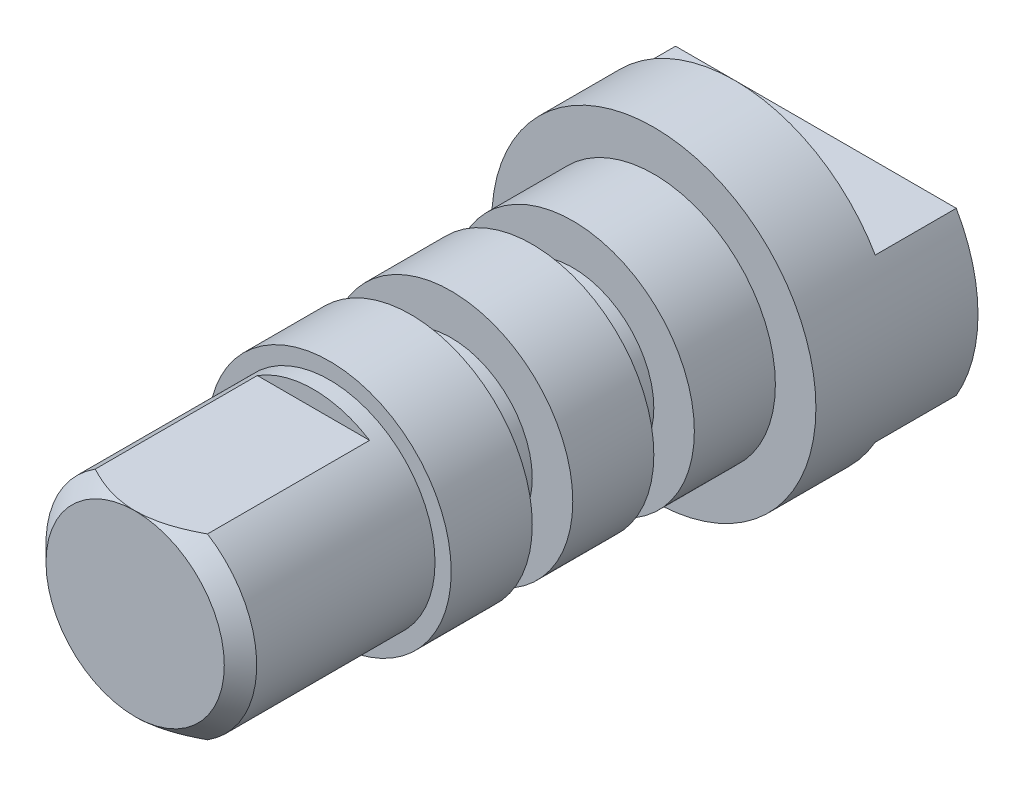
from build123d import *

# Parameters (mm, degrees)
SZKIC2_R                    = 10
DODANIE_WYCI_GNI_CIE1_DEPTH = 5
SZKIC3_R                    = 7.5
DODANIE_WYCI_GNI_CIE2_DEPTH = 5
SZKIC4_R                    = 5
DODANIE_WYCI_GNI_CIE3_DEPTH = 2.5
SZKIC5_R                    = 7.5
DODANIE_WYCI_GNI_CIE4_DEPTH = 5
SZKIC6_R                    = 5
DODANIE_WYCI_GNI_CIE5_DEPTH = 2.5
SZKIC7_R                    = 7.5
DODANIE_WYCI_GNI_CIE6_DEPTH = 5
SZKIC8_R                    = 6.5
DODANIE_WYCI_GNI_CIE7_DEPTH = 12
SZKIC10_W                   = 8
SZKIC10_H                   = 2
WYTNIJ_WYCI_GNI_CIE1_DEPTH  = 11
DODANIE_WYCI_GNI_CIE8_START = 5
SZKIC11_R                   = 10
DODANIE_WYCI_GNI_CIE8_DEPTH = 5
WYTNIJ_WYCI_GNI_CIE2_DEPTH  = 5


with BuildPart() as part:
    # Szkic2 → Dodanie-wyciągnięcie1 (new body)
    with BuildSketch(Plane.XY):
        Circle(SZKIC2_R)
    extrude(amount=DODANIE_WYCI_GNI_CIE1_DEPTH)

    # Szkic3 → Dodanie-wyciągnięcie2 (add)
    with BuildSketch(Plane.XY.offset(5)):
        Circle(SZKIC3_R)
    extrude(amount=DODANIE_WYCI_GNI_CIE2_DEPTH)

    # Szkic4 → Dodanie-wyciągnięcie3 (add)
    with BuildSketch(Plane.XY.offset(10)):
        Circle(SZKIC4_R)
    extrude(amount=DODANIE_WYCI_GNI_CIE3_DEPTH)

    # Szkic5 → Dodanie-wyciągnięcie4 (add)
    with BuildSketch(Plane.XY.offset(12.5)):
        Circle(SZKIC5_R)
    extrude(amount=DODANIE_WYCI_GNI_CIE4_DEPTH)

    # Szkic6 → Dodanie-wyciągnięcie5 (add)
    with BuildSketch(Plane.XY.offset(17.5)):
        Circle(SZKIC6_R)
    extrude(amount=DODANIE_WYCI_GNI_CIE5_DEPTH)

    # Szkic7 → Dodanie-wyciągnięcie6 (add)
    with BuildSketch(Plane.XY.offset(20)):
        Circle(SZKIC7_R)
    extrude(amount=DODANIE_WYCI_GNI_CIE6_DEPTH)

    # Szkic8 → Dodanie-wyciągnięcie7 (add)
    with BuildSketch(Plane.XY.offset(25)):
        Circle(SZKIC8_R)
    extrude(amount=DODANIE_WYCI_GNI_CIE7_DEPTH)

    # Szkic10 → Wytnij-wyciągnięcie1 (cut)
    with BuildSketch(Plane.XY.offset(37)):
        with Locations((0, 6.5)):
            Rectangle(SZKIC10_W, SZKIC10_H)
        with Locations((0, -6.5)):
            Rectangle(SZKIC10_W, SZKIC10_H)
    extrude(amount=-WYTNIJ_WYCI_GNI_CIE1_DEPTH, mode=Mode.SUBTRACT)

    # Szkic11 → Dodanie-wyciągnięcie8 (add)
    with BuildSketch(Plane(origin=(0, 0, 0), x_dir=(-1, 0, 0), z_dir=(0, 0, -1)).offset(DODANIE_WYCI_GNI_CIE8_START)):
        Circle(SZKIC11_R)
    extrude(amount=-DODANIE_WYCI_GNI_CIE8_DEPTH)

    # Szkic13 → Wytnij-wyciągnięcie2 (cut)
    with BuildSketch(Plane(origin=(0, 0, -5), x_dir=(-1, 0, 0), z_dir=(0, 0, -1))):
        with BuildLine():
            Line((-8.660254038, -5), (8.660254038, -5))
            ThreePointArc((8.660254038, -5), (0, -10), (-8.660254038, -5))
        make_face()
        with BuildLine():
            Line((-8.660254038, 5), (8.660254038, 5))
            ThreePointArc((8.660254038, 5), (0, 10), (-8.660254038, 5))
        make_face()
    extrude(amount=-WYTNIJ_WYCI_GNI_CIE2_DEPTH, mode=Mode.SUBTRACT)

    # Sfazowanie1: read off the stored shape, not the designer's step
    # Sfazowanie1 outline → Sfazowanie1 (revolve, cut)
    with BuildSketch(Plane.XZ):
        Polygon((6.5, 37.000001298), (5.499998702, 37.000001298), (6.5, 36), align=None)
    revolve(axis=Axis((0, 0, 0), (0, 0, 1)), mode=Mode.SUBTRACT)


solid = part.part
